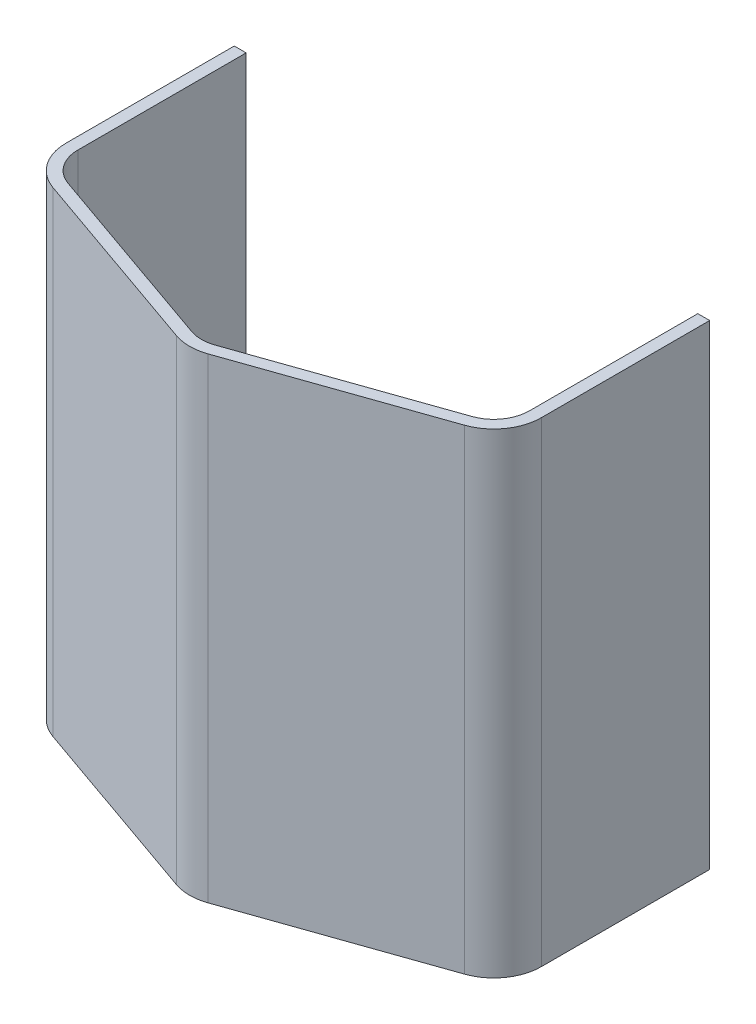
from build123d import *

# Parameters (mm, degrees)
BOSS_EXTRUDE1_DEPTH = 200
SHELL3_T            = -5


with BuildPart() as part:
    # Sketch1 → Boss-Extrude1 (new body)
    with BuildSketch(Plane(origin=(0, 0, 0), x_dir=(1, 0, 0), z_dir=(0, 1, 0))):
        with BuildLine():
            Line((0, 0), (200, 0))
            Line((200, 0), (200, -70.8103799))
            ThreePointArc((200, -70.8103799), (196.311654881, -82.383189198), (186.607008495, -89.687547027))
            Line((186.607008495, -89.687547027), (106.607008495, -117.687547027))
            ThreePointArc((106.607008495, -117.687547027), (100, -118.8103799), (93.392991505, -117.687547027))
            Line((93.392991505, -117.687547027), (13.392991505, -89.687547027))
            ThreePointArc((13.392991505, -89.687547027), (3.688345119, -82.383189198), (0, -70.8103799))
            Line((0, -70.8103799), (0, 0))
        make_face()
    extrude(amount=BOSS_EXTRUDE1_DEPTH)

    # Shell3
    shell3_openings = [part.faces().sort_by_distance(p)[0] for p in [
        (100, 0, 51.617363214),
        (100, 100, 0),
        (100, 200, 51.617363214),
    ]]
    offset(amount=SHELL3_T, openings=shell3_openings, kind=Kind.INTERSECTION)


solid = part.part
